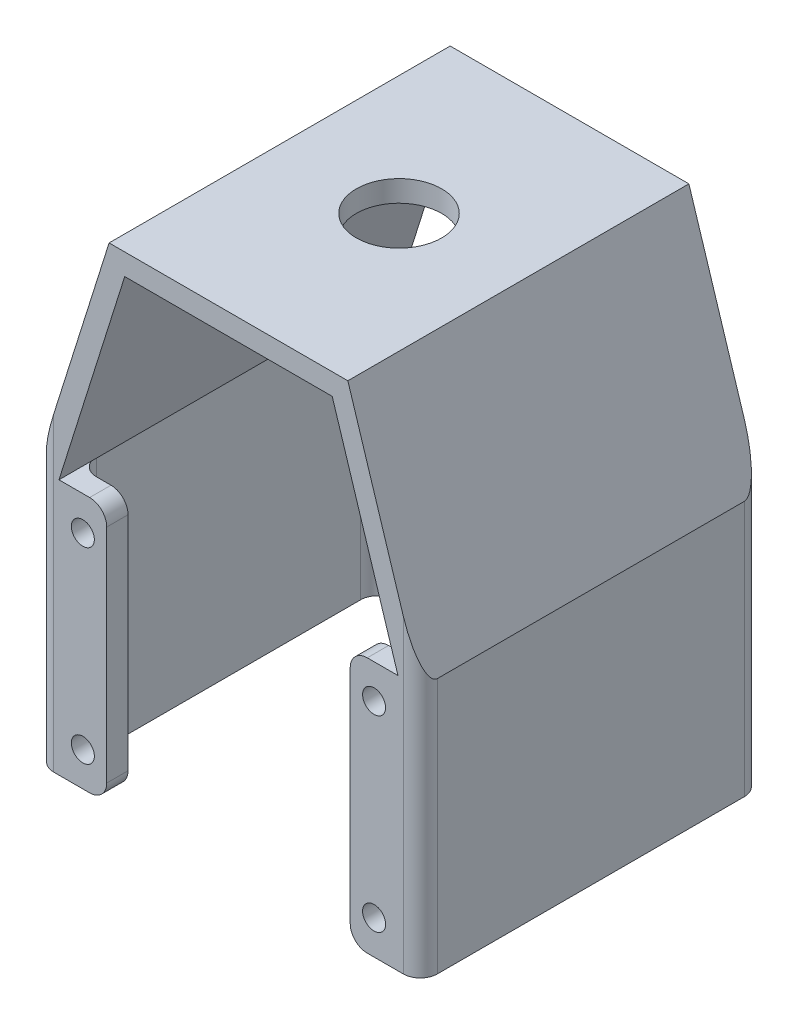
from build123d import *

# Parameters (mm, degrees)
ESBO_O1_W                = 45
ESBO_O1_H                = 57
RESSALTO_EXTRUS_O1_DEPTH = 40
CORTE_EXTRUS_O1_DEPTH    = 55.023143189
CORTE_EXTRUS_O3_DEPTH    = 55.023143189
CORTE_EXTRUS_O5_DEPTH    = 30
ESBO_O8_R                = 5
CORTE_EXTRUS_O7_DEPTH    = 74.179573653
FILETE1_R                = 2
FILETE2_R                = 2
ESBO_O7_W                = 3.279040768
ESBO_O7_H                = 30
CORTE_EXTRUS_O8_DEPTH    = 55.023143189
ESBO_O9_R                = 1.35
CORTE_EXTRUS_O9_DEPTH    = 55.023143189
FILETE3_R                = 2


with BuildPart() as part:
    # Esboço1 → Ressalto-extrusão1 (new body)
    with BuildSketch(Plane.XY):
        Rectangle(ESBO_O1_W, ESBO_O1_H)
    extrude(amount=RESSALTO_EXTRUS_O1_DEPTH)

    # Esboço3 → Corte-extrusão1 (cut, through all)
    with BuildSketch(Plane(origin=(0, 0, 0), x_dir=(-1, 0, 0), z_dir=(0, 0, -1))):
        Polygon((-22.5, 1.5), (-22.5, 28.5), (-14, 28.5), align=None)
        Polygon((22.5, 1.5), (14, 28.5), (22.5, 28.5), align=None)
    extrude(amount=-CORTE_EXTRUS_O1_DEPTH, mode=Mode.SUBTRACT)

    # Esboço5 → Corte-extrusão3 (cut, through all)
    with BuildSketch(Plane(origin=(0, 0, 0), x_dir=(-1, 0, 0), z_dir=(0, 0, -1))):
        Polygon((-19.879040768, 1.5), (-12.166077805, 26), (12.166077805, 26), (19.879040768, 1.5), align=None)
    extrude(amount=-CORTE_EXTRUS_O3_DEPTH, mode=Mode.SUBTRACT)

    # Esboço4 → Corte-extrusão5 (cut)
    with BuildSketch(Plane.XZ.offset(28.5)):
        Polygon((-20, 37.5), (-20, 2.5), (-11, 2.5), (-11, 0), (11, 0), (11, 2.5), (20, 2.5), (20, 37.5), (11, 37.5), (11, 40), (-11, 40), (-11, 37.5), align=None)
    extrude(amount=-CORTE_EXTRUS_O5_DEPTH, mode=Mode.SUBTRACT)

    # Esboço8 → Corte-extrusão7 (cut, through all)
    with BuildSketch(Plane(origin=(0, 28.5, 0), x_dir=(1, 0, 0), z_dir=(0, 1, 0))):
        with Locations(Location((0, -20, 0), (0, 0, 270))):
            Circle(ESBO_O8_R)
    extrude(amount=-CORTE_EXTRUS_O7_DEPTH, mode=Mode.SUBTRACT)

    # Filete1
    filete1_edges = [part.edges().sort_by_distance(p)[0] for p in [
        (-11, 1.5, 1.25),
        (-11, 1.5, 38.75),
        (11, 1.5, 38.75),
        (11, 1.5, 1.25),
        (-11, -28.5, 1.25),
        (11, -28.5, 1.25),
        (11, -28.5, 38.75),
        (-11, -28.5, 38.75),
    ]]
    fillet(filete1_edges, radius=FILETE1_R)

    # Filete2
    # the kernel refuses this fillet: 2 mm, written as the material it adds along each edge
    with BuildSketch(Plane(origin=(-20, -28.5, 2.5), x_dir=(1, 0, 0), z_dir=(0, 1, 0)), Plane(origin=(-20, -28.5, 37.5), x_dir=(0, 0, -1), z_dir=(0, 1, 0))) as filete2_piece_1:
        with BuildLine():
            CenterArc((FILETE2_R, -FILETE2_R), FILETE2_R, 90, 90)
            Line((0, -FILETE2_R), (-FILETE2_R * 0.02, -FILETE2_R))
            Line((-FILETE2_R * 0.02, -FILETE2_R), (-FILETE2_R * 0.02, FILETE2_R * 0.02))
            Line((-FILETE2_R * 0.02, FILETE2_R * 0.02), (FILETE2_R, FILETE2_R * 0.02))
            Line((FILETE2_R, FILETE2_R * 0.02), (FILETE2_R, 0))
        make_face()
    extrude(amount=30)
    with BuildSketch(Plane(origin=(20, -28.5, 37.5), x_dir=(0, 0, -1), z_dir=(0, 1, 0)), Plane(origin=(20, -28.5, 2.5), x_dir=(-1, 0, 0), z_dir=(0, 1, 0))) as filete2_piece_2:
        with BuildLine():
            CenterArc((FILETE2_R, FILETE2_R), FILETE2_R, 180, 90)
            Line((0, FILETE2_R), (-FILETE2_R * 0.02, FILETE2_R))
            Line((-FILETE2_R * 0.02, FILETE2_R), (-FILETE2_R * 0.02, -FILETE2_R * 0.02))
            Line((-FILETE2_R * 0.02, -FILETE2_R * 0.02), (FILETE2_R, -FILETE2_R * 0.02))
            Line((FILETE2_R, -FILETE2_R * 0.02), (FILETE2_R, 0))
        make_face()
    extrude(amount=30)
    filete2_2_edges = [part.edges().sort_by_distance(p)[0] for p in [
        (-22.5, -13.5, 0),
        (-22.5, -13.5, 40),
        (22.5, -13.5, 40),
        (22.5, -13.5, 0),
    ]]
    fillet(filete2_2_edges, radius=FILETE2_R)

    # Esboço7 → Corte-extrusão8 (cut, through all)
    with BuildSketch(Plane(origin=(0, 0, 0), x_dir=(-1, 0, 0), z_dir=(0, 0, -1))):
        with BuildLine():
            Line((-11, -26.5), (-11, -0.5))
            ThreePointArc((-11, -0.5), (-11.585786438, 0.914213562), (-13, 1.5))
            Line((-13, 1.5), (-14.279040768, 1.5))
            Line((-14.279040768, 1.5), (-14.279040768, -13.448376549))
            Line((-14.279040768, -13.448376549), (-14.279040768, -28.5))
            Line((-14.279040768, -28.5), (-13, -28.5))
            ThreePointArc((-13, -28.5), (-11.585786438, -27.914213562), (-11, -26.5))
        make_face()
        with Locations((12.639520384, -13.5)):
            Rectangle(ESBO_O7_W, ESBO_O7_H)
    extrude(amount=-CORTE_EXTRUS_O8_DEPTH, mode=Mode.SUBTRACT)

    # Esboço9 → Corte-extrusão9 (cut, through all)
    with BuildSketch(Plane(origin=(0, 0, 0), x_dir=(-1, 0, 0), z_dir=(0, 0, -1))):
        with Locations((-17.079040768, -24.5)):
            Circle(ESBO_O9_R)
        with Locations((-17.079040768, -2.5)):
            Circle(ESBO_O9_R)
        with Locations((17.079040768, -2.5)):
            Circle(ESBO_O9_R)
        with Locations((17.079040768, -24.5)):
            Circle(ESBO_O9_R)
    extrude(amount=-CORTE_EXTRUS_O9_DEPTH, mode=Mode.SUBTRACT)

    # Filete3
    filete3_edges = [part.edges().sort_by_distance(p)[0] for p in [
        (14.279040768, -28.5, 1.25),
        (14.279040768, -28.5, 38.75),
        (14.279040768, 1.5, 38.75),
        (14.279040768, 1.5, 1.25),
        (-14.279040768, 1.5, 1.25),
        (-14.279040768, 1.5, 38.75),
        (-14.279040768, -28.5, 38.75),
        (-14.279040768, -28.5, 1.25),
    ]]
    fillet(filete3_edges, radius=FILETE3_R)


solid = part.part
